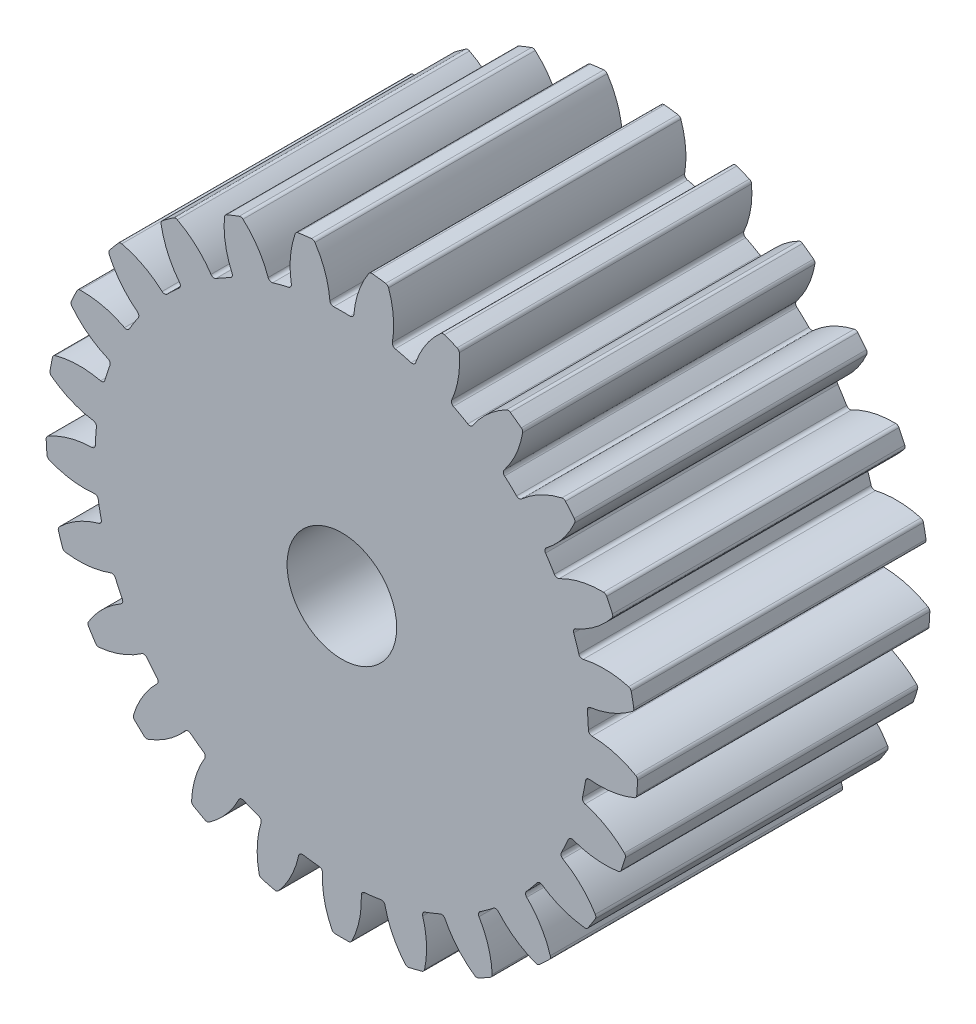
from build123d import *

# Parameters (mm, degrees)
SKETCH_1_R                       = 8.1
SKETCH_1_R_2                     = 1.5
EXTRUDE_1_DEPTH                  = 4
CUT_EXTRUDE_1_DEPTH              = 13.133424908
FILLET_1_R                       = 0.1
PATTERN_CIRCULAR_1_COUNT         = 25
FILLET_1_OF_PATTERN_CIRCULAR_1_R = 0.1


with BuildPart() as part:
    # Эскиз1 → Бобышка-Вытянуть1 (new, symmetric)
    with BuildSketch(Plane.XY):
        Circle(SKETCH_1_R)
        Circle(SKETCH_1_R_2, mode=Mode.SUBTRACT)
    extrude(amount=EXTRUDE_1_DEPTH, both=True)

    # Эскиз2 → Вырез-Вытянуть1 (cut, symmetric)
    with BuildSketch(Plane.XY):
        with BuildLine():
            ThreePointArc((0.321606761, 6.742334098), (0, 6.75), (-0.321606761, 6.742334098))
            ThreePointArc((-0.321606761, 6.742334098), (-0.453066216, 7.434446009), (-0.770725573, 8.063248855))
            ThreePointArc((-0.770725573, 8.063248855), (0, 8.1), (0.770725573, 8.063248855))
            ThreePointArc((0.770725573, 8.063248855), (0.453066216, 7.434446009), (0.321606761, 6.742334098))
        make_face()
    cut_extrude_1 = extrude(amount=CUT_EXTRUDE_1_DEPTH, both=True, mode=Mode.SUBTRACT)

    # Скругление1
    fillet_1_edges = [part.edges().sort_by_distance(p)[0] for p in [
        (0.770725573, 8.063248855, 0),
        (0.321606761, 6.742334098, 0),
        (-0.321606761, 6.742334098, 0),
        (-0.770725573, 8.063248855, 0),
    ]]
    fillet(fillet_1_edges, radius=FILLET_1_R)

    # Круговой массив1: Вырез-Вытянуть1 ×25 about axis
    pattern_circular_1_axis = Axis((0, 0, 4), (0, 0, -1))
    for i in range(1, PATTERN_CIRCULAR_1_COUNT):
        add(cut_extrude_1.rotate(pattern_circular_1_axis, i * 360 / PATTERN_CIRCULAR_1_COUNT), mode=Mode.SUBTRACT)

    # Скругление1 of Круговой массив1
    fillet_1_of_pattern_circular_1_edges = [part.edges().sort_by_distance(p)[0] for p in [
        (2.75176026, 7.618255409, 0),
        (1.9882532, 6.450530925, 0),
        (1.365247413, 6.610491623, 0),
        (1.258736636, 8.00159872, 0),
        (4.559891729, 6.694578957, 0),
        (3.529970377, 5.75341717, 0),
        (2.96631807, 6.063287648, 0),
        (3.209107793, 7.437178711, 0),
        (6.081508431, 5.350257489, 0),
        (4.849886534, 4.694795055, 0),
        (4.381004055, 5.135105011, 0),
        (4.957838904, 6.405453411, 0),
        (7.221001592, 3.669759666, 0),
        (5.865066482, 3.341181701, 0),
        (5.520415442, 3.88426484, 0),
        (6.395050764, 4.971249915, 0),
        (7.906772666, 1.758677347, 0),
        (6.511722734, 1.777629612, 0),
        (6.312958824, 2.389362024, 0),
        (7.430438066, 3.224684505, 0),
        (8.095732134, -0.262909138, 0),
        (6.749223498, 0.102382517, 0),
        (6.708835786, 0.744326805, 0),
        (7.998943616, 1.275500307, 0),
        (7.776006978, -2.267976075, 0),
        (6.562645727, -1.579297648, 0),
        (6.683171922, -0.947477205, 0),
        (8.06484612, -0.753828266, 0),
        (6.967686706, -4.130537734, 0),
        (5.96371279, -3.161744734, 0),
        (6.237579788, -2.579747738, 0),
        (7.624004683, -2.735791036, 0),
        (5.721561052, -5.733562516, 0),
        (4.990057845, -4.54552777, 0),
        (5.400057575, -4.049923232, 0),
        (6.704118992, -4.545853994, 0),
        (4.115928675, -6.976326479, 0),
        (3.702859213, -5.643698579, 0),
        (4.223229884, -5.265627156, 0),
        (5.362988849, -6.070284228, 0),
        (2.251677363, -7.780742192, 0),
        (2.18299632, -6.38725505, 0),
        (2.781041128, -6.150472359, 0),
        (3.684882393, -7.213296178, 0),
        (0.24594488, -8.096265257, 0),
        (0.525967738, -6.729476795, 0),
        (1.16410933, -6.648860765, 0),
        (1.775241224, -7.903070201, 0),
        (-1.775241224, -7.903070201, 0),
        (-1.16410933, -6.648860765, 0),
        (-0.525967738, -6.729476795, 0),
        (-0.24594488, -8.096265257, 0),
        (-3.684882393, -7.213296178, 0),
        (-2.781041128, -6.150472359, 0),
        (-2.18299632, -6.38725505, 0),
        (-2.251677363, -7.780742192, 0),
        (-5.362988849, -6.070284228, 0),
        (-4.223229884, -5.265627156, 0),
        (-3.702859213, -5.643698579, 0),
        (-4.115928675, -6.976326479, 0),
        (-6.704118992, -4.545853994, 0),
        (-5.400057575, -4.049923232, 0),
        (-4.990057845, -4.54552777, 0),
        (-5.721561052, -5.733562516, 0),
        (-7.624004683, -2.735791036, 0),
        (-6.237579788, -2.579747738, 0),
        (-5.96371279, -3.161744734, 0),
        (-6.967686706, -4.130537734, 0),
        (-8.06484612, -0.753828266, 0),
        (-6.683171922, -0.947477205, 0),
        (-6.562645727, -1.579297648, 0),
        (-7.776006978, -2.267976075, 0),
        (-7.998943616, 1.275500307, 0),
        (-6.708835786, 0.744326805, 0),
        (-6.749223498, 0.102382517, 0),
        (-8.095732134, -0.262909138, 0),
        (-7.430438066, 3.224684505, 0),
        (-6.312958824, 2.389362024, 0),
        (-6.511722734, 1.777629612, 0),
        (-7.906772666, 1.758677347, 0),
        (-6.395050764, 4.971249915, 0),
        (-5.520415442, 3.88426484, 0),
        (-5.865066482, 3.341181701, 0),
        (-7.221001592, 3.669759666, 0),
        (-4.957838904, 6.405453411, 0),
        (-4.381004055, 5.135105011, 0),
        (-4.849886534, 4.694795055, 0),
        (-6.081508431, 5.350257489, 0),
        (-3.209107793, 7.437178711, 0),
        (-2.96631807, 6.063287648, 0),
        (-3.529970377, 5.75341717, 0),
        (-4.559891729, 6.694578957, 0),
        (-1.258736636, 8.00159872, 0),
        (-1.365247413, 6.610491623, 0),
        (-1.9882532, 6.450530925, 0),
        (-2.75176026, 7.618255409, 0),
    ]]
    fillet(fillet_1_of_pattern_circular_1_edges, radius=FILLET_1_OF_PATTERN_CIRCULAR_1_R)


solid = part.part
